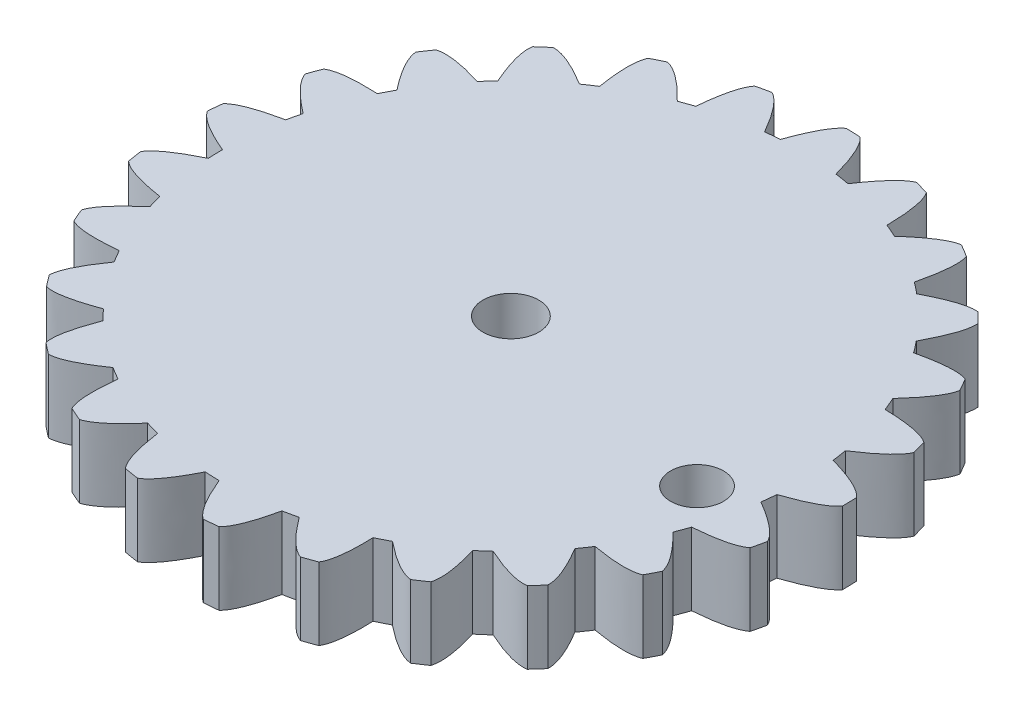
from build123d import *

# Parameters (mm, degrees)
BOSS_EXTRUDE4_DEPTH = 5
CIRPATTERN6_COUNT   = 25
SKETCH2_R           = 1.925
CUT_EXTRUDE2_DEPTH  = 10
SKETCH4_R           = 1.825
CUT_EXTRUDE3_DEPTH  = 10


with BuildPart() as part:
    # Sketch1 → Boss-Extrude4 (new body)
    with BuildSketch(Plane(origin=(0, 0, 0), x_dir=(1, 0, 0), z_dir=(0, 1, 0))):
        with BuildLine():
            ThreePointArc((16.557704719, 15.665416514), (16.210089226, 16.024851556), (15.854672926, 16.376574933))
            add(Edge.make_bspline(
                [(15.854672926, 16.376574933), (14.90209329, 16.487130706), (12.672917576, 15.335678456)],
                knots=[0.6252108, 0.6252108, 0.6252108, 1, 1, 1], degree=2))
            ThreePointArc((12.672917576, 15.335678456), (-14.148047219, -13.986373136), (15.480310361, 12.495833895))
            add(Edge.make_bspline(
                [(15.480310361, 12.495833895), (16.657305579, 14.711629216), (16.557704719, 15.665416514)],
                knots=[0, 0, 0, 0.3747892, 0.3747892, 0.3747892], degree=2))
        make_face()
    boss_extrude4 = extrude(amount=BOSS_EXTRUDE4_DEPTH)

    # CirPattern6: Boss-Extrude4 ×25 about axis
    cirpattern6_axis = Axis((0, 5, 0), (0, 1, 0))
    for i in range(1, CIRPATTERN6_COUNT):
        add(boss_extrude4.rotate(cirpattern6_axis, i * 360 / CIRPATTERN6_COUNT))

    # Sketch2 → Cut-Extrude2 (cut)
    with BuildSketch(Plane(origin=(0, 5, 0), x_dir=(1, 0, 0), z_dir=(0, 1, 0))):
        Circle(SKETCH2_R)
    extrude(amount=-CUT_EXTRUDE2_DEPTH, mode=Mode.SUBTRACT)

    # Sketch4 → Cut-Extrude3 (cut)
    with BuildSketch(Plane.XZ):
        with Locations((16.58409767, 3.737339222)):
            Circle(SKETCH4_R)
    extrude(amount=-CUT_EXTRUDE3_DEPTH, mode=Mode.SUBTRACT)


solid = part.part
